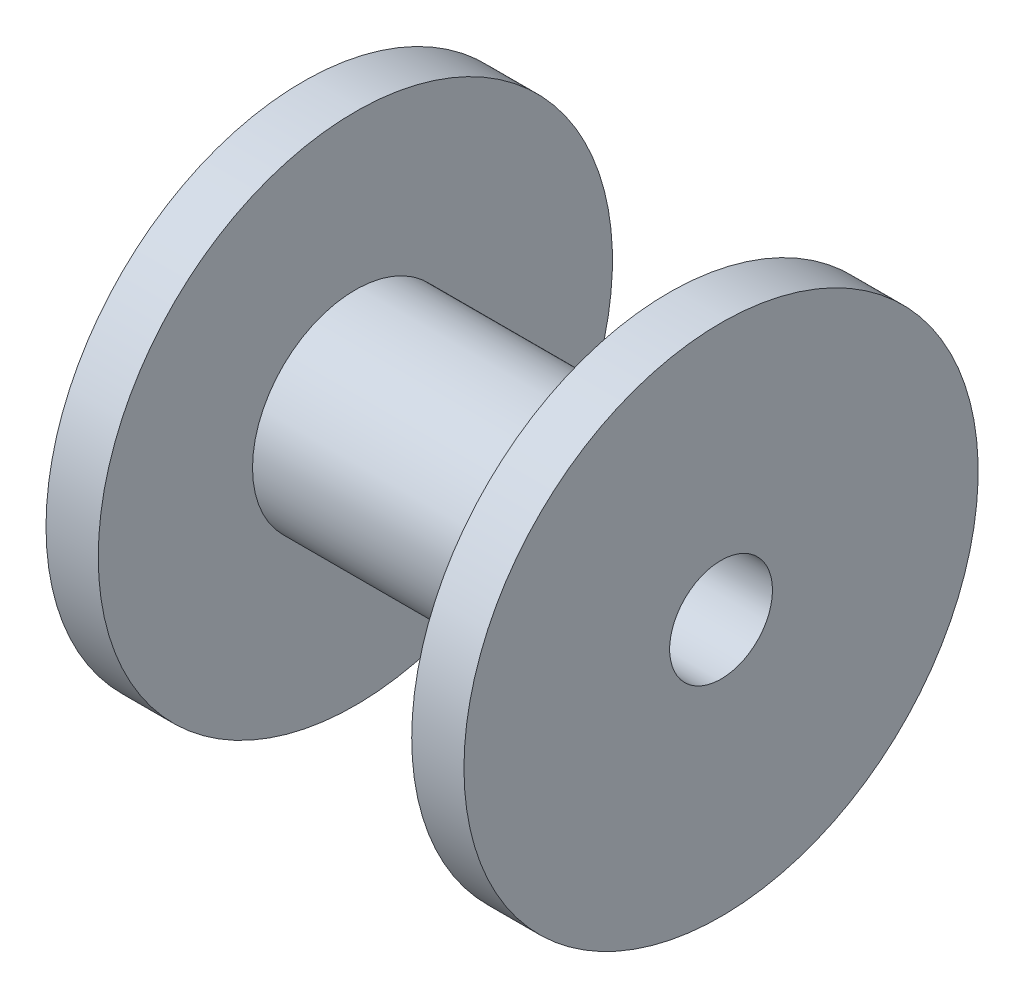
from build123d import *

# Parameters (mm, degrees)
SKETCH2_R          = 5
CUT_EXTRUDE1_DEPTH = 40.64


with BuildPart() as part:
    # Sketch1 → Revolve1 (revolve)
    with BuildSketch(Plane.XY):
        Polygon((0, 0), (40.64, 0), (40.64, -25), (35.56, -25), (35.56, -10), (5.08, -10), (5.08, -25), (0, -25), align=None)
    revolve(axis=Axis((0, 0, 0), (1, 0, 0)))

    # Sketch2 → Cut-Extrude1 (cut)
    with BuildSketch(Plane(origin=(40.64, 0, 0), x_dir=(0, 0, -1), z_dir=(1, 0, 0))):
        Circle(SKETCH2_R)
    extrude(amount=-CUT_EXTRUDE1_DEPTH, mode=Mode.SUBTRACT)


solid = part.part
